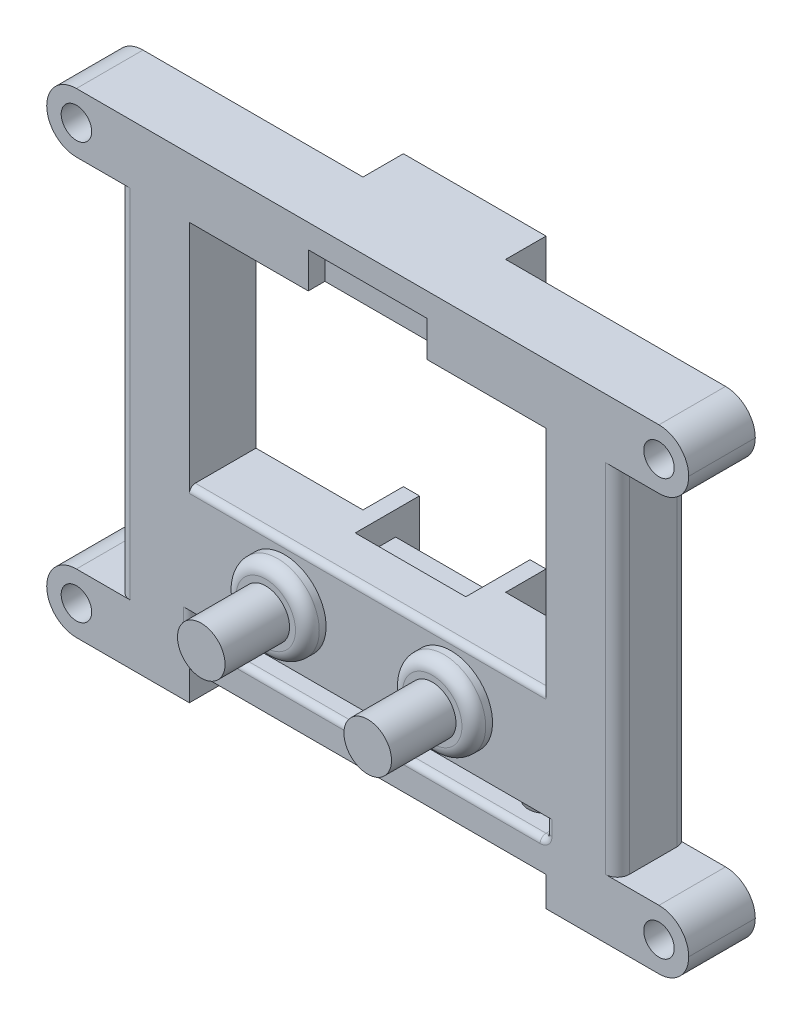
from build123d import *

# Parameters (mm, degrees)
BOSS_EXTRUDE2_DEPTH  = 3.81
FILLET1_R            = 3.175
CUT_EXTRUDE1_REACH   = 61.178
SKETCH4_R            = 1.627
FILLET2_R            = 1.27
CUT_EXTRUDE2_REACH   = 60.809
SKETCH5_R            = 1.905
SKETCH6_W            = 38.1
SKETCH6_H            = 11.43
BOSS_EXTRUDE3_DEPTH  = 7.62
SKETCH7_R            = 2.54
BOSS_EXTRUDE4_DEPTH  = 8.89
SKETCH8_R            = 4.445
BOSS_EXTRUDE5_DEPTH  = 2
FILLET3_R            = 1.27
FILLET3_OF_MIRROR3_R = 1.27
FILLET4_R            = 0.635
CUT_EXTRUDE3_START   = -0.508
CUT_EXTRUDE3_DEPTH   = 0.508
SKETCH13_W           = 12.7
SKETCH13_H           = 3.81
CUT_EXTRUDE4_DEPTH   = 1.778
SKETCH14_W           = 11.811
SKETCH14_H           = 2.54
CUT_EXTRUDE5_DEPTH   = 2.54
SKETCH15_W           = 15.24
SKETCH15_H           = 6.35
BOSS_EXTRUDE6_DEPTH  = 1.778
BOSS_EXTRUDE7_DEPTH  = 2.54
BOSS_EXTRUDE8_DEPTH  = 2.54


# Read off the part's stored shape, not the designer's step: Cut-Extrude3
with BuildPart() as part:
    # Sketch3 → Boss-Extrude2 (new, symmetric)
    with BuildSketch(Plane.XY):
        Polygon((34.29, -3.175), (34.29, 3.175), (26.67, 3.175), (26.67, 41.275), (34.29, 41.275), (34.29, 47.625), (0, 47.625), (-34.29, 47.625), (-34.29, 41.275), (-26.67, 41.275), (-26.67, 3.175), (-34.29, 3.175), (-34.29, -3.175), (-19.05, -3.175), (-19.05, 0), (19.05, 0), (19.05, -3.175), align=None)
        Polygon((-19.05, 3.175), (-19.05, 41.275), (0, 41.275), (19.05, 41.275), (19.05, 3.175), align=None, mode=Mode.SUBTRACT)
    extrude(amount=BOSS_EXTRUDE2_DEPTH, both=True)

    # Fillet1
    fillet1_edges = [part.edges().sort_by_distance(p)[0] for p in [
        (34.29, 3.175, 0),
        (34.29, 41.275, 0),
        (34.29, 47.625, 0),
        (-34.29, 3.175, 0),
        (-34.29, 41.275, 0),
        (-34.29, 47.625, 0),
        (34.29, -3.175, 0),
        (-34.29, -3.175, 0),
    ]]
    fillet(fillet1_edges, radius=FILLET1_R - 0.0001)  # a hair under: the kernel refuses the full size

    # Sketch4 → Cut-Extrude1 (cut, up to next)
    with BuildSketch(Plane.XY.offset(3.81), mode=Mode.PRIVATE) as cut_extrude1_sk1:
        with Locations((-31.115, 44.45)):
            Circle(SKETCH4_R)
    cut_extrude1_tool1 = extrude(cut_extrude1_sk1.sketch, amount=-CUT_EXTRUDE1_REACH, mode=Mode.PRIVATE) & part.part
    # Sketch4 → Cut-Extrude1 (cut, up to next)
    with BuildSketch(Plane.XY.offset(3.81), mode=Mode.PRIVATE) as cut_extrude1_sk2:
        with Locations((-31.115, 0)):
            Circle(SKETCH4_R)
    cut_extrude1_tool2 = extrude(cut_extrude1_sk2.sketch, amount=-CUT_EXTRUDE1_REACH, mode=Mode.PRIVATE) & part.part
    cut_extrude1_1 = cut_extrude1_tool1.solids().sort_by_distance((-31.115, 44.45, 3.81))[0]
    add(cut_extrude1_1, mode=Mode.SUBTRACT)
    cut_extrude1_2 = cut_extrude1_tool2.solids().sort_by_distance((-31.115, 0, 3.81))[0]
    add(cut_extrude1_2, mode=Mode.SUBTRACT)
    cut_extrude1 = cut_extrude1_1 + cut_extrude1_2  # Cut-Extrude1 as one shape, for the pattern or mirror that repeats it

    # Mirror1: Cut-Extrude1 across plane
    add(cut_extrude1.mirror(Plane(origin=(0, 0, 0), x_dir=(0, 0, 1), z_dir=(1, 0, 0))), mode=Mode.SUBTRACT)

    # Fillet2
    fillet2_edges = [part.edges().sort_by_distance(p)[0] for p in [
        (-26.67, 22.225, -3.81),
        (26.67, 22.225, -3.81),
        (26.67, 22.225, 3.81),
        (-26.67, 22.225, 3.81),
    ]]
    fillet(fillet2_edges, radius=FILLET2_R)

    # Sketch5 → Cut-Extrude2 (cut, up to next)
    with BuildSketch(Plane.XZ, mode=Mode.PRIVATE) as cut_extrude2_sk1:
        with Locations((-15.24, 0)):
            Circle(SKETCH5_R)
    cut_extrude2_tool1 = extrude(cut_extrude2_sk1.sketch, amount=-CUT_EXTRUDE2_REACH, mode=Mode.PRIVATE) & part.part
    # Sketch5 → Cut-Extrude2 (cut, up to next)
    with BuildSketch(Plane.XZ, mode=Mode.PRIVATE) as cut_extrude2_sk2:
        with Locations(Location((15.24, 0, 0), (0, 0, 180))):
            Circle(SKETCH5_R)
    cut_extrude2_tool2 = extrude(cut_extrude2_sk2.sketch, amount=-CUT_EXTRUDE2_REACH, mode=Mode.PRIVATE) & part.part
    add(cut_extrude2_tool1.solids().sort_by_distance((-15.24, 0, 0))[0], mode=Mode.SUBTRACT)
    add(cut_extrude2_tool2.solids().sort_by_distance((15.24, 0, 0))[0], mode=Mode.SUBTRACT)

    # Sketch6 → Boss-Extrude3 (add)
    with BuildSketch(Plane.XY.offset(3.81)):
        with Locations((0, 11.1125)):
            Rectangle(SKETCH6_W, SKETCH6_H)
    extrude(amount=-BOSS_EXTRUDE3_DEPTH)

    # Sketch7 → Boss-Extrude4 (add)
    with BuildSketch(Plane.XY.offset(3.81)):
        with Locations(Location((-8.89, 11.176999998, 0), (0, 0, 180))):
            Circle(SKETCH7_R)
        with Locations(Location((8.89, 11.176999998, 0), (0, 0, 180))):
            Circle(SKETCH7_R)
    extrude(amount=BOSS_EXTRUDE4_DEPTH)

    # Sketch8 → Boss-Extrude5 (add)
    with BuildSketch(Plane.XY.offset(3.81)):
        with Locations(Location((-8.89, 11.176999998, 0), (0, 0, 180))):
            Circle(SKETCH8_R)
    boss_extrude5 = extrude(amount=BOSS_EXTRUDE5_DEPTH)

    # Fillet3
    fillet3_edges = [part.edges().sort_by_distance(p)[0] for p in [
        (-4.445, 11.176999998, 5.81),
    ]]
    fillet(fillet3_edges, radius=FILLET3_R)

    # Mirror3: Boss-Extrude5 across plane
    add(boss_extrude5.mirror(Plane(origin=(0, 0, 0), x_dir=(0, 0, 1), z_dir=(1, 0, 0))))

    # Fillet3 of Mirror3
    fillet3_of_mirror3_edges = [part.edges().sort_by_distance(p)[0] for p in [
        (4.445, 11.176999998, 5.81),
    ]]
    fillet(fillet3_of_mirror3_edges, radius=FILLET3_OF_MIRROR3_R)

    # Fillet4
    fillet4_edges = [part.edges().sort_by_distance(p)[0] for p in [
        (19.05, 4.28625, 3.81),
        (19.05, 4.28625, -3.81),
        (-19.05, 4.28625, 3.81),
        (-19.05, 4.28625, -3.81),
        (0, 16.8275, 3.81),
        (19.05, 3.175, 0),
        (-19.05, 3.175, 0),
        (0, 3.175, -3.81),
        (0, 3.175, 3.81),
    ]]
    fillet(fillet4_edges, radius=FILLET4_R)

    # Cut-Extrude3 outline → Cut-Extrude3 (cut)
    with BuildSketch(Plane(origin=(0, 0, -3.81), x_dir=(-1, 0, 0), z_dir=(0, 0, -1)).offset(CUT_EXTRUDE3_START)):
        Polygon((-36, 41.275), (-25.4, 41.275), (-25.4, 3.175), (-36, 3.175), (-36, -5), (36, -5), (36, 3.175), (25.4, 3.175), (25.4, 41.275), (36, 41.275), (36, 49), (-36, 49), align=None)
    extrude(amount=CUT_EXTRUDE3_DEPTH, mode=Mode.SUBTRACT)

    # Sketch13 → Cut-Extrude4 (cut)
    with BuildSketch(Plane.XY.offset(3.81)):
        with Locations((0, 43.18)):
            Rectangle(SKETCH13_W, SKETCH13_H)
    extrude(amount=-CUT_EXTRUDE4_DEPTH, mode=Mode.SUBTRACT)

    # Sketch14 → Cut-Extrude5 (cut)
    with BuildSketch(Plane(origin=(0, 0, -3.302), x_dir=(-1, 0, 0), z_dir=(0, 0, -1))):
        with Locations((0, 15.5575)):
            Rectangle(SKETCH14_W, SKETCH14_H)
    extrude(amount=-CUT_EXTRUDE5_DEPTH, mode=Mode.SUBTRACT)

    # Sketch15 → Boss-Extrude6 (add)
    with BuildSketch(Plane(origin=(0, 0, -3.302), x_dir=(-1, 0, 0), z_dir=(0, 0, -1))):
        with Locations((0, 44.45)):
            Rectangle(SKETCH15_W, SKETCH15_H)
        Polygon((-7.62, 16.8275), (-5.9055, 16.8275), (-5.9055, 14.2875), (5.9055, 14.2875), (5.9055, 16.8275), (7.62, 16.8275), (7.62, 9.2075), (-7.62, 9.2075), align=None)
    extrude(amount=BOSS_EXTRUDE6_DEPTH)

    # Sketch16 → Boss-Extrude7 (add)
    with BuildSketch(Plane(origin=(0, 0, -5.08), x_dir=(-1, 0, 0), z_dir=(0, 0, -1))):
        Polygon((-5.9055, 41.275), (-5.9055, 42.926), (5.9055, 42.926), (5.9055, 41.275), (7.62, 41.275), (7.62, 47.625), (-7.62, 47.625), (-7.62, 41.275), align=None)
    extrude(amount=BOSS_EXTRUDE7_DEPTH)

    # Sketch18 → Boss-Extrude8 (add)
    with BuildSketch(Plane(origin=(0, 0, -5.08), x_dir=(-1, 0, 0), z_dir=(0, 0, -1))):
        Polygon((-7.62, 16.8275), (-5.9055, 16.8275), (-5.9055, 10.4902), (5.9055, 10.4902), (5.9055, 16.8275), (7.62, 16.8275), (7.62, 9.2075), (-7.62, 9.2075), align=None)
    extrude(amount=BOSS_EXTRUDE8_DEPTH)


solid = part.part
